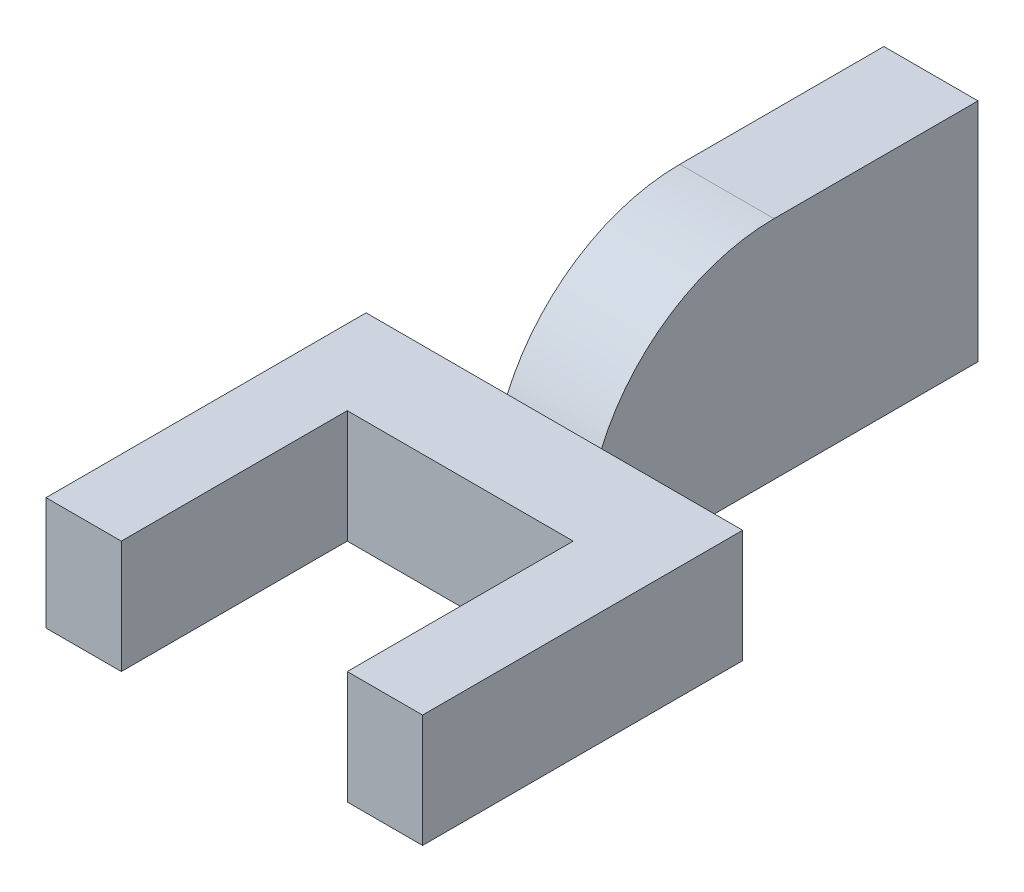
from build123d import *

# Parameters (mm, degrees)
BOSS_EXTRUDE1_DEPTH     = 12
SKETCH3_W               = 5
SKETCH3_H               = 20
BOSS_EXTRUDE2_DEPTH     = 12
CUT_EXTRUDE1_DEPTH      = 44.1052491
CUT_EXTRUDE1_DEPTH_BACK = 44.1052491
SKETCH4_W               = 17
SKETCH4_H               = 6
FILLET1_R               = 10


with BuildPart() as part:
    # Sketch2 → Boss-Extrude1 (new body)
    with BuildSketch(Plane(origin=(0, 0, 0), x_dir=(1, 0, 0), z_dir=(0, 1, 0))):
        Polygon((-6, -0.75), (-6, 11.25), (6, 11.25), (6, -0.75), (10, -0.75), (10, 16.25), (-10, 16.25), (-10, -0.75), align=None)
    extrude(amount=BOSS_EXTRUDE1_DEPTH)

    # Sketch3 → Boss-Extrude2 (add)
    with BuildSketch(Plane(origin=(0, 12, 0), x_dir=(1, 0, 0), z_dir=(0, 1, 0))):
        with Locations((0, 26.25)):
            Rectangle(SKETCH3_W, SKETCH3_H)
    extrude(amount=-BOSS_EXTRUDE2_DEPTH)

    # Sketch4 → Cut-Extrude1 (cut, two sides: drawn at the far end of the back side and taken through both)
    with BuildSketch(Plane(origin=(10, 0, 0), x_dir=(0, 0, -1), z_dir=(1, 0, 0)).offset(-CUT_EXTRUDE1_DEPTH_BACK)):
        with Locations((7.75, 9)):
            Rectangle(SKETCH4_W, SKETCH4_H)
    extrude(amount=CUT_EXTRUDE1_DEPTH + CUT_EXTRUDE1_DEPTH_BACK, mode=Mode.SUBTRACT)

    # Fillet1
    # the kernel refuses this fillet: 10 mm, written as the material it takes off along each edge
    with BuildSketch(Plane(origin=(25.412878475, 12, -16.25), x_dir=(0, -1, 0), z_dir=(-1, 0, 0))) as fillet1_piece_1:
        with BuildLine():
            CenterArc((10, -9.16515139), FILLET1_R, 113.578178478, 66.421821522)
            Line((0, -9.16515139), (-0.2, -9.16515139))
            Line((-0.2, -9.16515139), (-0.2, 0))
            Line((-0.2, 0), (0, 0.2))
            ThreePointArc((0, 0.2), (3, 0.2), (5.92, 0.183303028))
            Line((5.92, 0.183303028), (6, 0))
        make_face()
    extrude(amount=50.82575695, mode=Mode.SUBTRACT)


solid = part.part
